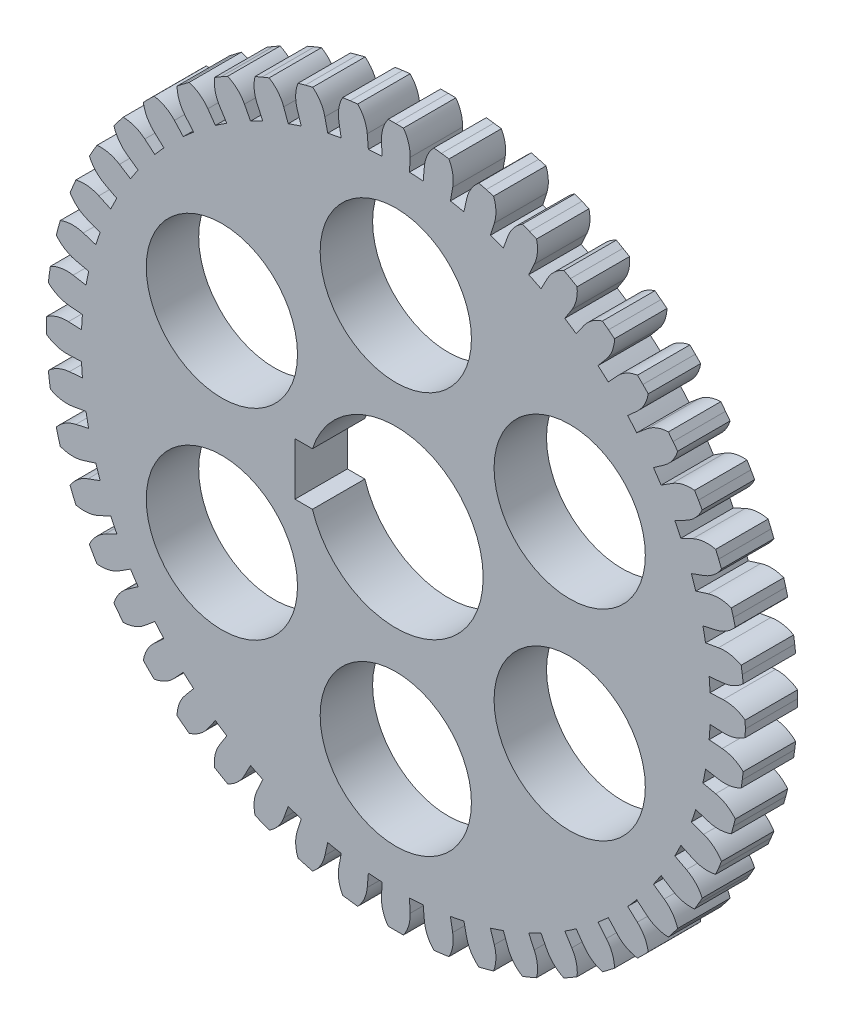
from build123d import *

# Parameters (mm, degrees)
BOSS_EXTRU_3_DEPTH           = 3
R_P_TITION_CIRCULAIRE1_COUNT = 48
ESQUISSE2_R                  = 5
ESQUISSE2_R_2                = 4.327622663
ENL_V_MAT_EXTRU_1_DEPTH      = 3
ENL_V_START                  = -3
ENL_V_MAT_EXTRU_2_DEPTH      = 3


with BuildPart() as part:
    # Esquisse1 → Boss.-Extru.3 (new body)
    with BuildSketch(Plane.XY):
        with BuildLine():
            Line((17.982867988, 0.785148973), (18.732154155, 0.817863513))
            ThreePointArc((18.732154155, 0.817863513), (19.396152631, 0.734516401), (19.995240542, 0.436297701))
            Line((19.995240542, 0.436297701), (20, 0))
            Line((20, 0), (19.995240542, -0.436297701))
            ThreePointArc((19.995240542, -0.436297701), (19.396152631, -0.734516401), (18.732154155, -0.817863513))
            Line((18.732154155, -0.817863513), (17.982867988, -0.785148973))
            ThreePointArc((17.982867988, -0.785148973), (17.961460618, -1.177256326), (17.931504566, -1.568803369))
            Line((17.931504566, -1.568803369), (0, 0))
            Line((0, 0), (17.931504566, 1.568803369))
            ThreePointArc((17.931504566, 1.568803369), (17.961460618, 1.177256326), (17.982867988, 0.785148973))
        make_face()
    boss_extru_3 = extrude(amount=BOSS_EXTRU_3_DEPTH)

    # Répétition circulaire1: Boss.-Extru.3 ×48 about axis
    r_p_tition_circulaire1_axis = Axis((0, 0, 0), (0, 0, 1))
    for i in range(1, R_P_TITION_CIRCULAIRE1_COUNT):
        add(boss_extru_3.rotate(r_p_tition_circulaire1_axis, i * 360 / R_P_TITION_CIRCULAIRE1_COUNT))

    # Esquisse2 → Enlèv. mat.-Extru.1 (cut)
    with BuildSketch(Plane(origin=(0, 0, 0), x_dir=(-1, 0, 0), z_dir=(0, 0, -1))):
        Circle(ESQUISSE2_R)
        with Locations((0, 11.491433994)):
            Circle(ESQUISSE2_R_2)
        with Locations((9.951873765, 5.745716997)):
            Circle(ESQUISSE2_R_2)
        with Locations((9.951873765, -5.745716997)):
            Circle(ESQUISSE2_R_2)
        with Locations((0, -11.491433994)):
            Circle(ESQUISSE2_R_2)
        with Locations((-9.951873765, -5.745716997)):
            Circle(ESQUISSE2_R_2)
        with Locations((-9.951873765, 5.745716997)):
            Circle(ESQUISSE2_R_2)
    extrude(amount=-ENL_V_MAT_EXTRU_1_DEPTH, mode=Mode.SUBTRACT)

    # Esquisse3 → Enlèv. mat.-Extru.2 (cut)
    with BuildSketch(Plane.XY.offset(3).offset(ENL_V_START)):
        with BuildLine():
            Line((-5.769696007, -1.5), (-4.769696007, -1.5))
            ThreePointArc((-4.769696007, -1.5), (-5, 0), (-4.769696007, 1.5))
            Line((-4.769696007, 1.5), (-5.769696007, 1.5))
            Line((-5.769696007, 1.5), (-5.769696007, -1.5))
        make_face()
    extrude(amount=ENL_V_MAT_EXTRU_2_DEPTH, mode=Mode.SUBTRACT)


solid = part.part
